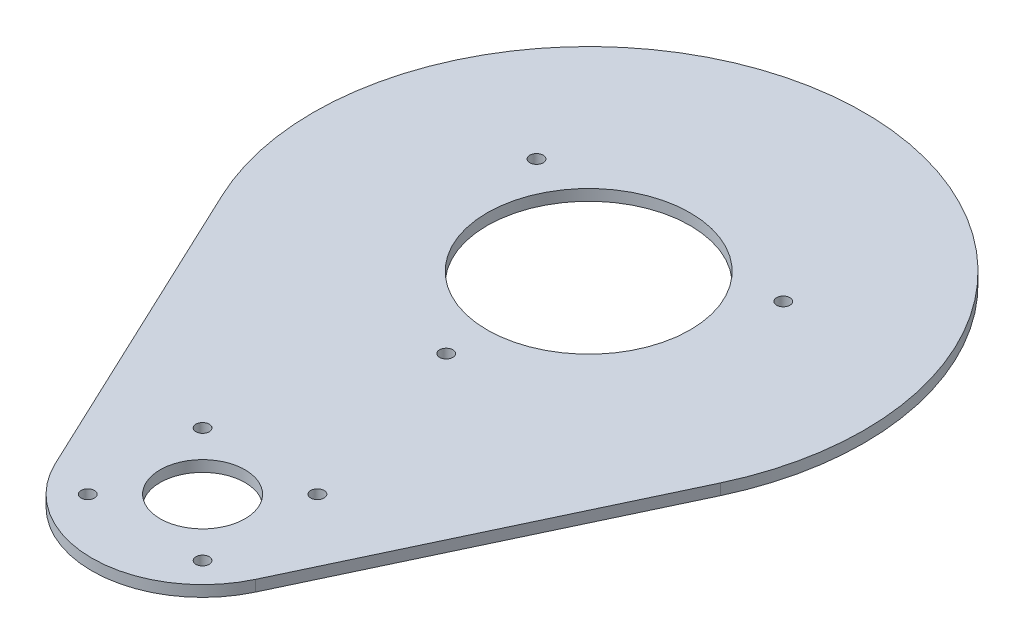
from build123d import *

# Parameters (mm, degrees)
SKETCH1_W            = 150
SKETCH1_H            = 220
BOSS_EXTRUDE1_DEPTH  = 3
HOLE1_D              = 55
HOLE1_DEPTH          = 100
HOLE2_D              = 23
HOLE2_DEPTH          = 100
M3_CLEARANCE_HOLE1_D = 3.6
SKETCH10_W           = 150
SKETCH10_H           = 220
CUT_EXTRUDE3_DEPTH   = 10
M3_CLEARANCE_HOLE2_D = 3.6


with BuildPart() as part:
    # Sketch1 → Boss-Extrude1 (new body)
    with BuildSketch(Plane(origin=(0, 32, 0), x_dir=(1, 0, 0), z_dir=(0, 1, 0))):
        with Locations((0, -25.362515428)):
            Rectangle(SKETCH1_W, SKETCH1_H)
    extrude(amount=BOSS_EXTRUDE1_DEPTH)

    # Hole1
    with Locations(Plane(origin=(0, 35, 0), x_dir=(1, 0, 0), z_dir=(0, 1, 0))):
        with Locations((0, 0)):
            Hole(HOLE1_D / 2, depth=HOLE1_DEPTH)

    # Hole2
    with Locations(Plane(origin=(0, 35, 0), x_dir=(1, 0, 0), z_dir=(0, 1, 0))):
        with Locations((0, -104.6)):
            Hole(HOLE2_D / 2, depth=HOLE2_DEPTH)

    # M3 Clearance Hole1 (through all)
    with Locations(Plane(origin=(0, 35, 0), x_dir=(1, 0, 0), z_dir=(0, 1, 0))):
        with Locations((-15.556349186, -89.043650814), (15.556349186, -89.043650814), (15.556349186, -120.156349186), (-15.556349186, -120.156349186)):
            Hole(M3_CLEARANCE_HOLE1_D / 2)

    # Sketch10 → Cut-Extrude3 (cut)
    with BuildSketch(Plane(origin=(0, 32, 0), x_dir=(1, 0, 0), z_dir=(0, 1, 0))):
        with Locations((0, -25.362515428)):
            Rectangle(SKETCH10_W, SKETCH10_H)
        with BuildLine():
            Line((-27.13623596, -117.391586998), (-67.47877342, -31.808413002))
            ThreePointArc((-67.47877342, -31.808413002), (-16.297906351, 72.797927502), (74.6, 0))
            ThreePointArc((74.6, 0), (72.797927502, -16.297906351), (67.47877342, -31.808413002))
            Line((67.47877342, -31.808413002), (27.13623596, -117.391586998))
            ThreePointArc((27.13623596, -117.391586998), (0, -134.6), (-27.13623596, -117.391586998))
        make_face(mode=Mode.SUBTRACT)
    extrude(amount=CUT_EXTRUDE3_DEPTH, mode=Mode.SUBTRACT)

    # M3 Clearance Hole2 (through all)
    with Locations(Plane(origin=(0, 32, 0), x_dir=(-1, 0, 0), z_dir=(0, -1, 0))):
        with Locations((-33.428580586, 19.3), (33.428580586, 19.3), (0, -38.6)):
            Hole(M3_CLEARANCE_HOLE2_D / 2)


solid = part.part
